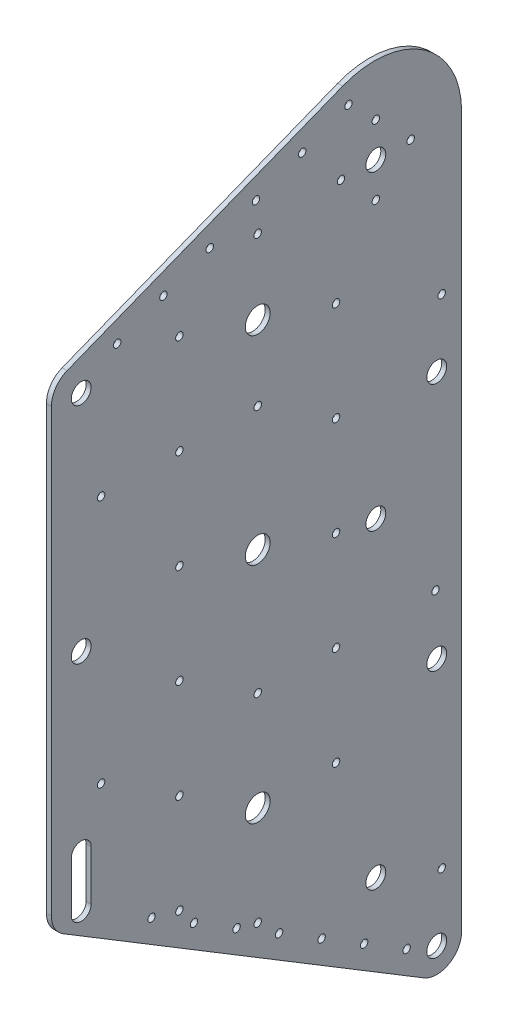
from build123d import *

# Parameters (mm, degrees)
BOSS_EXTRUDE1_DEPTH = 2
FILLET1_R           = 10
SKETCH3_R           = 1.5
SKETCH3_R_2         = 4
SKETCH3_R_3         = 5
CUT_EXTRUDE1_DEPTH  = 2
FILLET2_R           = 35


with BuildPart() as part:
    # Sketch2 → Boss-Extrude1 (new body)
    with BuildSketch(Plane(origin=(0, 0, 0), x_dir=(0, 1, 0), z_dir=(-1, 0, 0))):
        Polygon((0, 0), (65, 165), (-290, 165), (-190, 0), align=None)
    extrude(amount=BOSS_EXTRUDE1_DEPTH)

    # Fillet1
    fillet1_edges = [part.edges().sort_by_distance(p)[0] for p in [
        (-1, -190, 0),
        (-1, -290, -165),
        (-1, 0, 0),
    ]]
    fillet(fillet1_edges, radius=FILLET1_R)

    # Sketch3 → Cut-Extrude1 (cut)
    with BuildSketch(Plane(origin=(-2, 0, 0), x_dir=(0, 1, 0), z_dir=(-1, 0, 0))):
        with Locations((-228.170289346, 83)):
            Circle(SKETCH3_R)
        with Locations((-246.246193102, 157)):
            Circle(SKETCH3_R)
        with Locations((-46.246193102, 157)):
            Circle(SKETCH3_R)
        with Locations((11.829710654, 83)):
            Circle(SKETCH3_R)
        with Locations((13.829710654, 144.5)):
            Circle(SKETCH3_R)
        with Locations((27.829710654, 130.5)):
            Circle(SKETCH3_R)
        with Locations((13.829710654, 116.5)):
            Circle(SKETCH3_R)
        with Locations((-0.170289346, 130.5)):
            Circle(SKETCH3_R)
        with Locations((-272.246193102, 155)):
            Circle(SKETCH3_R_2)
        with Locations((-172.246193102, 155)):
            Circle(SKETCH3_R_2)
        with Locations((13.829710654, 130.5)):
            Circle(SKETCH3_R_2)
        with Locations((-236.170289346, 130.5)):
            Circle(SKETCH3_R_2)
        with Locations((-111.170289346, 130.5)):
            Circle(SKETCH3_R_2)
        with Locations((-18.170289346, 83)):
            Circle(SKETCH3_R_3)
        with Locations((-188.170289346, 83)):
            Circle(SKETCH3_R_3)
        with Locations((-98.170289346, 83)):
            Circle(SKETCH3_R_3)
        with Locations((-205.049987171, 40.267503937)):
            Circle(SKETCH3_R)
        with Locations((-208.170289346, 51.5)):
            Circle(SKETCH3_R)
        with Locations((-225.782055815, 74.475417199)):
            Circle(SKETCH3_R)
        with Locations((-236.148090136, 91.57937383)):
            Circle(SKETCH3_R)
        with Locations((-246.514124458, 108.683330462)):
            Circle(SKETCH3_R)
        with Locations((-256.88015878, 125.787287093)):
            Circle(SKETCH3_R)
        with Locations((-267.246193102, 142.891243724)):
            Circle(SKETCH3_R)
        with Locations((1.829710654, 26.47129363)):
            Circle(SKETCH3_R)
        with Locations((9.160201021, 45.079461487)):
            Circle(SKETCH3_R)
        with Locations((16.490691389, 63.687629343)):
            Circle(SKETCH3_R)
        with Locations((23.821181757, 82.295797199)):
            Circle(SKETCH3_R)
        with Locations((31.151672124, 100.903965056)):
            Circle(SKETCH3_R)
        with Locations((38.482162492, 119.512132912)):
            Circle(SKETCH3_R)
        with Locations((-72.246193102, 155)):
            Circle(SKETCH3_R_2)
        with Locations((-148.170289346, 154.5)):
            Circle(SKETCH3_R)
        with Locations((-188.170289346, 114.5)):
            Circle(SKETCH3_R)
        with Locations((-148.170289346, 114.5)):
            Circle(SKETCH3_R)
        with Locations((-108.170289346, 114.5)):
            Circle(SKETCH3_R)
        with Locations((-68.170289346, 114.5)):
            Circle(SKETCH3_R)
        with Locations((-28.170289346, 114.5)):
            Circle(SKETCH3_R)
        with Locations((-148.170289346, 83)):
            Circle(SKETCH3_R)
        with Locations((-215.416021493, 57.371460568)):
            Circle(SKETCH3_R)
        with Locations((-168.170289346, 51.5)):
            Circle(SKETCH3_R)
        with Locations((-8.170289346, 51.5)):
            Circle(SKETCH3_R)
        with Locations((-128.170289346, 51.5)):
            Circle(SKETCH3_R)
        with Locations((-88.170289346, 51.5)):
            Circle(SKETCH3_R)
        with Locations((-48.170289346, 83)):
            Circle(SKETCH3_R)
        with Locations((-48.170289346, 51.5)):
            Circle(SKETCH3_R)
        with Locations((-8.170289346, 12)):
            Circle(SKETCH3_R_2)
        with Locations((-148.170289346, 20)):
            Circle(SKETCH3_R)
        with Locations((-98.170289346, 12)):
            Circle(SKETCH3_R_2)
        with Locations((-48.170289346, 20)):
            Circle(SKETCH3_R)
        with BuildLine():
            Line((-188.170289346, 8), (-168.170289346, 8))
            ThreePointArc((-168.170289346, 8), (-164.170289346, 12), (-168.170289346, 16))
            Line((-168.170289346, 16), (-188.170289346, 16))
            ThreePointArc((-188.170289346, 16), (-192.170289346, 12), (-188.170289346, 8))
        make_face()
    extrude(amount=-CUT_EXTRUDE1_DEPTH, mode=Mode.SUBTRACT)

    # Fillet2
    fillet2_edges = [part.edges().sort_by_distance(p)[0] for p in [
        (-1, 65, -165),
    ]]
    fillet(fillet2_edges, radius=FILLET2_R)


solid = part.part
